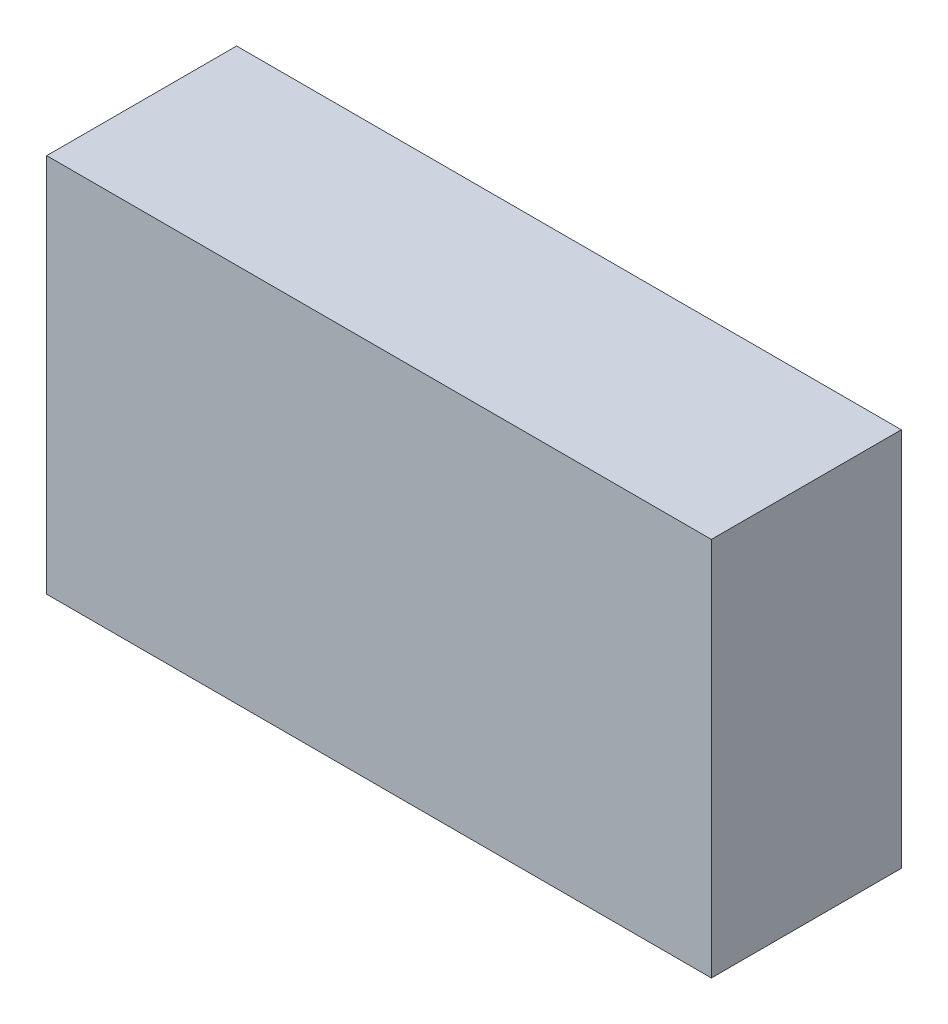
from build123d import *

# Parameters (mm, degrees)
SKETCH1_W           = 88.9
SKETCH1_H           = 50.8
BOSS_EXTRUDE1_DEPTH = 25.4


with BuildPart() as part:
    # Sketch1 → Boss-Extrude1 (new body)
    with BuildSketch(Plane.XY):
        with Locations((44.45, 25.4)):
            Rectangle(SKETCH1_W, SKETCH1_H)
    extrude(amount=BOSS_EXTRUDE1_DEPTH)


solid = part.part
